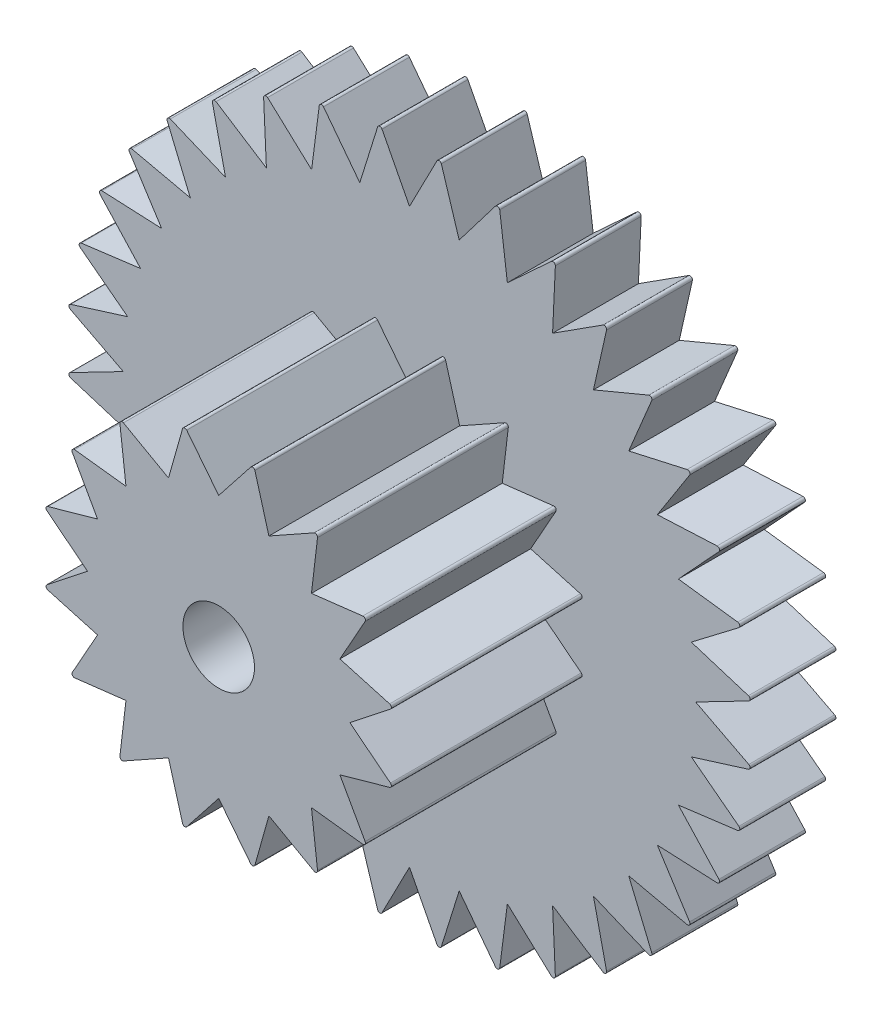
from build123d import *

# Parameters (mm, degrees)
SKETCH_1_R              = 7.25
EXTRUDE_1_DEPTH         = 1.8
SKETCH_2_R              = 3.75
EXTRUDE_2_DEPTH         = 4
SKETCH_3_R              = 0.75
CUT_EXTRUDE_3_DEPTH     = 12.779855687
CUT_EXTRUDE_START       = -4
CUT_EXTRUDE_4_OUTLINE_R = 3.75
CUT_EXTRUDE_4_DEPTH     = 4
SKETCH_5_R              = 7.25
CUT_EXTRUDE_5_DEPTH     = 4


# Read off the part's stored shape, not the designer's step: 伸長4
with BuildPart() as part:
    # 草圖1 → 伸長1 (new body)
    with BuildSketch(Plane.XY):
        Circle(SKETCH_1_R)
    extrude(amount=EXTRUDE_1_DEPTH)

    # 草圖2 → 伸長2 (add)
    with BuildSketch(Plane.XY.offset(1.8)):
        Circle(SKETCH_2_R)
    extrude(amount=EXTRUDE_2_DEPTH)

    # 草圖3 → 伸長3 (cut, through all)
    with BuildSketch(Plane.XY.offset(5.8)):
        Circle(SKETCH_3_R)
    extrude(amount=-CUT_EXTRUDE_3_DEPTH, mode=Mode.SUBTRACT)

    # 伸長4 outline → 伸長4 (cut)
    with BuildSketch(Plane.XY.offset(5.8).offset(CUT_EXTRUDE_START)):
        Circle(CUT_EXTRUDE_4_OUTLINE_R)
        with BuildLine():
            Line((-0.670839415, 3.600890591), (0, 2.75))
            Line((0, 2.75), (0.670839415, 3.600890591))
            ThreePointArc((0.670839415, 3.600890591), (0.719858625, 3.618973696), (0.758226366, 3.583508246))
            Line((0.758226366, 3.583508246), (1.052379439, 2.540668714))
            Line((1.052379439, 2.540668714), (1.997775976, 3.070069986))
            ThreePointArc((1.997775976, 3.070069986), (2.049983926, 3.068017757), (2.071859056, 3.020569255))
            Line((2.071859056, 3.020569255), (1.944543648, 1.944543648))
            Line((1.944543648, 1.944543648), (3.020569255, 2.071859056))
            ThreePointArc((3.020569255, 2.071859056), (3.068017757, 2.049983926), (3.070069986, 1.997775976))
            Line((3.070069986, 1.997775976), (2.540668714, 1.052379439))
            Line((2.540668714, 1.052379439), (3.583508246, 0.758226366))
            ThreePointArc((3.583508246, 0.758226366), (3.618973696, 0.719858625), (3.600890591, 0.670839415))
            Line((3.600890591, 0.670839415), (2.75, 0))
            Line((2.75, 0), (3.600890591, -0.670839415))
            ThreePointArc((3.600890591, -0.670839415), (3.618973696, -0.719858625), (3.583508246, -0.758226366))
            Line((3.583508246, -0.758226366), (2.540668714, -1.052379439))
            Line((2.540668714, -1.052379439), (3.070069986, -1.997775976))
            ThreePointArc((3.070069986, -1.997775976), (3.068017757, -2.049983926), (3.020569255, -2.071859056))
            Line((3.020569255, -2.071859056), (1.944543648, -1.944543648))
            Line((1.944543648, -1.944543648), (2.071859056, -3.020569255))
            ThreePointArc((2.071859056, -3.020569255), (2.049983926, -3.068017757), (1.997775976, -3.070069986))
            Line((1.997775976, -3.070069986), (1.052379439, -2.540668714))
            Line((1.052379439, -2.540668714), (0.758226366, -3.583508246))
            ThreePointArc((0.758226366, -3.583508246), (0.719858625, -3.618973696), (0.670839415, -3.600890591))
            Line((0.670839415, -3.600890591), (0, -2.75))
            Line((0, -2.75), (-0.670839415, -3.600890591))
            ThreePointArc((-0.670839415, -3.600890591), (-0.719858625, -3.618973696), (-0.758226366, -3.583508246))
            Line((-0.758226366, -3.583508246), (-1.052379439, -2.540668714))
            Line((-1.052379439, -2.540668714), (-1.997775976, -3.070069986))
            ThreePointArc((-1.997775976, -3.070069986), (-2.049983926, -3.068017757), (-2.071859056, -3.020569255))
            Line((-2.071859056, -3.020569255), (-1.944543648, -1.944543648))
            Line((-1.944543648, -1.944543648), (-3.020569255, -2.071859056))
            ThreePointArc((-3.020569255, -2.071859056), (-3.068017757, -2.049983926), (-3.070069986, -1.997775976))
            Line((-3.070069986, -1.997775976), (-2.540668714, -1.052379439))
            Line((-2.540668714, -1.052379439), (-3.583508246, -0.758226366))
            ThreePointArc((-3.583508246, -0.758226366), (-3.618973696, -0.719858625), (-3.600890591, -0.670839415))
            Line((-3.600890591, -0.670839415), (-2.75, 0))
            Line((-2.75, 0), (-3.600890591, 0.670839415))
            ThreePointArc((-3.600890591, 0.670839415), (-3.618973696, 0.719858625), (-3.583508246, 0.758226366))
            Line((-3.583508246, 0.758226366), (-2.540668714, 1.052379439))
            Line((-2.540668714, 1.052379439), (-3.070069986, 1.997775976))
            ThreePointArc((-3.070069986, 1.997775976), (-3.068017757, 2.049983926), (-3.020569255, 2.071859056))
            Line((-3.020569255, 2.071859056), (-1.944543648, 1.944543648))
            Line((-1.944543648, 1.944543648), (-2.071859056, 3.020569255))
            ThreePointArc((-2.071859056, 3.020569255), (-2.049983926, 3.068017757), (-1.997775976, 3.070069986))
            Line((-1.997775976, 3.070069986), (-1.052379439, 2.540668714))
            Line((-1.052379439, 2.540668714), (-0.758226366, 3.583508246))
            ThreePointArc((-0.758226366, 3.583508246), (-0.719858625, 3.618973696), (-0.670839415, 3.600890591))
        make_face(mode=Mode.SUBTRACT)
    extrude(amount=CUT_EXTRUDE_4_DEPTH, mode=Mode.SUBTRACT)

    # 草圖5 → 伸長5 (cut)
    with BuildSketch(Plane.XY.offset(1.8).offset(CUT_EXTRUDE_START)):
        Circle(SKETCH_5_R)
        with BuildLine():
            Line((-0.575995056, 7.11430015), (0, 6))
            Line((0, 6), (0.575995056, 7.11430015))
            ThreePointArc((0.575995056, 7.11430015), (0.624769694, 7.141150284), (0.66814086, 7.106238437))
            Line((0.66814086, 7.106238437), (1.041889066, 5.908846518))
            Line((1.041889066, 5.908846518), (1.802629653, 6.906197454))
            ThreePointArc((1.802629653, 6.906197454), (1.855325772, 6.924170046), (1.891975654, 6.882257265))
            Line((1.891975654, 6.882257265), (2.05212086, 5.638155725))
            Line((2.05212086, 5.638155725), (2.97449226, 6.488253442))
            ThreePointArc((2.97449226, 6.488253442), (3.029508715, 6.496802406), (3.058323725, 6.449162188))
            Line((3.058323725, 6.449162188), (3, 5.196152423))
            Line((3, 5.196152423), (4.055976426, 5.873167133))
            ThreePointArc((4.055976426, 5.873167133), (4.111641569, 5.872032711), (4.131746177, 5.820112582))
            Line((4.131746177, 5.820112582), (3.856725658, 4.596266659))
            Line((3.856725658, 4.596266659), (5.0142218, 5.079627612))
            ThreePointArc((5.0142218, 5.079627612), (5.068844274, 5.068844274), (5.079627612, 5.0142218))
            Line((5.079627612, 5.0142218), (4.596266659, 3.856725658))
            Line((4.596266659, 3.856725658), (5.820112582, 4.131746177))
            ThreePointArc((5.820112582, 4.131746177), (5.872032711, 4.111641569), (5.873167133, 4.055976426))
            Line((5.873167133, 4.055976426), (5.196152423, 3))
            Line((5.196152423, 3), (6.449162188, 3.058323725))
            ThreePointArc((6.449162188, 3.058323725), (6.496802406, 3.029508715), (6.488253442, 2.97449226))
            Line((6.488253442, 2.97449226), (5.638155725, 2.05212086))
            Line((5.638155725, 2.05212086), (6.882257265, 1.891975654))
            ThreePointArc((6.882257265, 1.891975654), (6.924170046, 1.855325772), (6.906197454, 1.802629653))
            Line((6.906197454, 1.802629653), (5.908846518, 1.041889066))
            Line((5.908846518, 1.041889066), (7.106238437, 0.66814086))
            ThreePointArc((7.106238437, 0.66814086), (7.141150284, 0.624769694), (7.11430015, 0.575995056))
            Line((7.11430015, 0.575995056), (6, 0))
            Line((6, 0), (7.11430015, -0.575995056))
            ThreePointArc((7.11430015, -0.575995056), (7.141150284, -0.624769694), (7.106238437, -0.66814086))
            Line((7.106238437, -0.66814086), (5.908846518, -1.041889066))
            Line((5.908846518, -1.041889066), (6.906197454, -1.802629653))
            ThreePointArc((6.906197454, -1.802629653), (6.924170046, -1.855325772), (6.882257265, -1.891975654))
            Line((6.882257265, -1.891975654), (5.638155725, -2.05212086))
            Line((5.638155725, -2.05212086), (6.488253442, -2.97449226))
            ThreePointArc((6.488253442, -2.97449226), (6.496802406, -3.029508715), (6.449162188, -3.058323725))
            Line((6.449162188, -3.058323725), (5.196152423, -3))
            Line((5.196152423, -3), (5.873167133, -4.055976426))
            ThreePointArc((5.873167133, -4.055976426), (5.872032711, -4.111641569), (5.820112582, -4.131746177))
            Line((5.820112582, -4.131746177), (4.596266659, -3.856725658))
            Line((4.596266659, -3.856725658), (5.079627612, -5.0142218))
            ThreePointArc((5.079627612, -5.0142218), (5.068844274, -5.068844274), (5.0142218, -5.079627612))
            Line((5.0142218, -5.079627612), (3.856725658, -4.596266659))
            Line((3.856725658, -4.596266659), (4.131746177, -5.820112582))
            ThreePointArc((4.131746177, -5.820112582), (4.111641569, -5.872032711), (4.055976426, -5.873167133))
            Line((4.055976426, -5.873167133), (3, -5.196152423))
            Line((3, -5.196152423), (3.058323725, -6.449162188))
            ThreePointArc((3.058323725, -6.449162188), (3.029508715, -6.496802406), (2.97449226, -6.488253442))
            Line((2.97449226, -6.488253442), (2.05212086, -5.638155725))
            Line((2.05212086, -5.638155725), (1.891975654, -6.882257265))
            ThreePointArc((1.891975654, -6.882257265), (1.855325772, -6.924170046), (1.802629653, -6.906197454))
            Line((1.802629653, -6.906197454), (1.041889066, -5.908846518))
            Line((1.041889066, -5.908846518), (0.66814086, -7.106238437))
            ThreePointArc((0.66814086, -7.106238437), (0.624769694, -7.141150284), (0.575995056, -7.11430015))
            Line((0.575995056, -7.11430015), (0, -6))
            Line((0, -6), (-0.575995056, -7.11430015))
            ThreePointArc((-0.575995056, -7.11430015), (-0.624769694, -7.141150284), (-0.66814086, -7.106238437))
            Line((-0.66814086, -7.106238437), (-1.041889066, -5.908846518))
            Line((-1.041889066, -5.908846518), (-1.802629653, -6.906197454))
            ThreePointArc((-1.802629653, -6.906197454), (-1.855325772, -6.924170046), (-1.891975654, -6.882257265))
            Line((-1.891975654, -6.882257265), (-2.05212086, -5.638155725))
            Line((-2.05212086, -5.638155725), (-2.97449226, -6.488253442))
            ThreePointArc((-2.97449226, -6.488253442), (-3.029508715, -6.496802406), (-3.058323725, -6.449162188))
            Line((-3.058323725, -6.449162188), (-3, -5.196152423))
            Line((-3, -5.196152423), (-4.055976426, -5.873167133))
            ThreePointArc((-4.055976426, -5.873167133), (-4.111641569, -5.872032711), (-4.131746177, -5.820112582))
            Line((-4.131746177, -5.820112582), (-3.856725658, -4.596266659))
            Line((-3.856725658, -4.596266659), (-5.0142218, -5.079627612))
            ThreePointArc((-5.0142218, -5.079627612), (-5.068844274, -5.068844274), (-5.079627612, -5.0142218))
            Line((-5.079627612, -5.0142218), (-4.596266659, -3.856725658))
            Line((-4.596266659, -3.856725658), (-5.820112582, -4.131746177))
            ThreePointArc((-5.820112582, -4.131746177), (-5.872032711, -4.111641569), (-5.873167133, -4.055976426))
            Line((-5.873167133, -4.055976426), (-5.196152423, -3))
            Line((-5.196152423, -3), (-6.449162188, -3.058323725))
            ThreePointArc((-6.449162188, -3.058323725), (-6.496802406, -3.029508715), (-6.488253442, -2.97449226))
            Line((-6.488253442, -2.97449226), (-5.638155725, -2.05212086))
            Line((-5.638155725, -2.05212086), (-6.882257265, -1.891975654))
            ThreePointArc((-6.882257265, -1.891975654), (-6.924170046, -1.855325772), (-6.906197454, -1.802629653))
            Line((-6.906197454, -1.802629653), (-5.908846518, -1.041889066))
            Line((-5.908846518, -1.041889066), (-7.106238437, -0.66814086))
            ThreePointArc((-7.106238437, -0.66814086), (-7.141150284, -0.624769694), (-7.11430015, -0.575995056))
            Line((-7.11430015, -0.575995056), (-6, 0))
            Line((-6, 0), (-7.11430015, 0.575995056))
            ThreePointArc((-7.11430015, 0.575995056), (-7.141150284, 0.624769694), (-7.106238437, 0.66814086))
            Line((-7.106238437, 0.66814086), (-5.908846518, 1.041889066))
            Line((-5.908846518, 1.041889066), (-6.906197454, 1.802629653))
            ThreePointArc((-6.906197454, 1.802629653), (-6.924170046, 1.855325772), (-6.882257265, 1.891975654))
            Line((-6.882257265, 1.891975654), (-5.638155725, 2.05212086))
            Line((-5.638155725, 2.05212086), (-6.488253442, 2.97449226))
            ThreePointArc((-6.488253442, 2.97449226), (-6.496802406, 3.029508715), (-6.449162188, 3.058323725))
            Line((-6.449162188, 3.058323725), (-5.196152423, 3))
            Line((-5.196152423, 3), (-5.873167133, 4.055976426))
            ThreePointArc((-5.873167133, 4.055976426), (-5.872032711, 4.111641569), (-5.820112582, 4.131746177))
            Line((-5.820112582, 4.131746177), (-4.596266659, 3.856725658))
            Line((-4.596266659, 3.856725658), (-5.079627612, 5.0142218))
            ThreePointArc((-5.079627612, 5.0142218), (-5.068844274, 5.068844274), (-5.0142218, 5.079627612))
            Line((-5.0142218, 5.079627612), (-3.856725658, 4.596266659))
            Line((-3.856725658, 4.596266659), (-4.131746177, 5.820112582))
            ThreePointArc((-4.131746177, 5.820112582), (-4.111641569, 5.872032711), (-4.055976426, 5.873167133))
            Line((-4.055976426, 5.873167133), (-3, 5.196152423))
            Line((-3, 5.196152423), (-3.058323725, 6.449162188))
            ThreePointArc((-3.058323725, 6.449162188), (-3.029508715, 6.496802406), (-2.97449226, 6.488253442))
            Line((-2.97449226, 6.488253442), (-2.05212086, 5.638155725))
            Line((-2.05212086, 5.638155725), (-1.891975654, 6.882257265))
            ThreePointArc((-1.891975654, 6.882257265), (-1.855325772, 6.924170046), (-1.802629653, 6.906197454))
            Line((-1.802629653, 6.906197454), (-1.041889066, 5.908846518))
            Line((-1.041889066, 5.908846518), (-0.66814086, 7.106238437))
            ThreePointArc((-0.66814086, 7.106238437), (-0.624769694, 7.141150284), (-0.575995056, 7.11430015))
        make_face(mode=Mode.SUBTRACT)
    extrude(amount=CUT_EXTRUDE_5_DEPTH, mode=Mode.SUBTRACT)


solid = part.part
